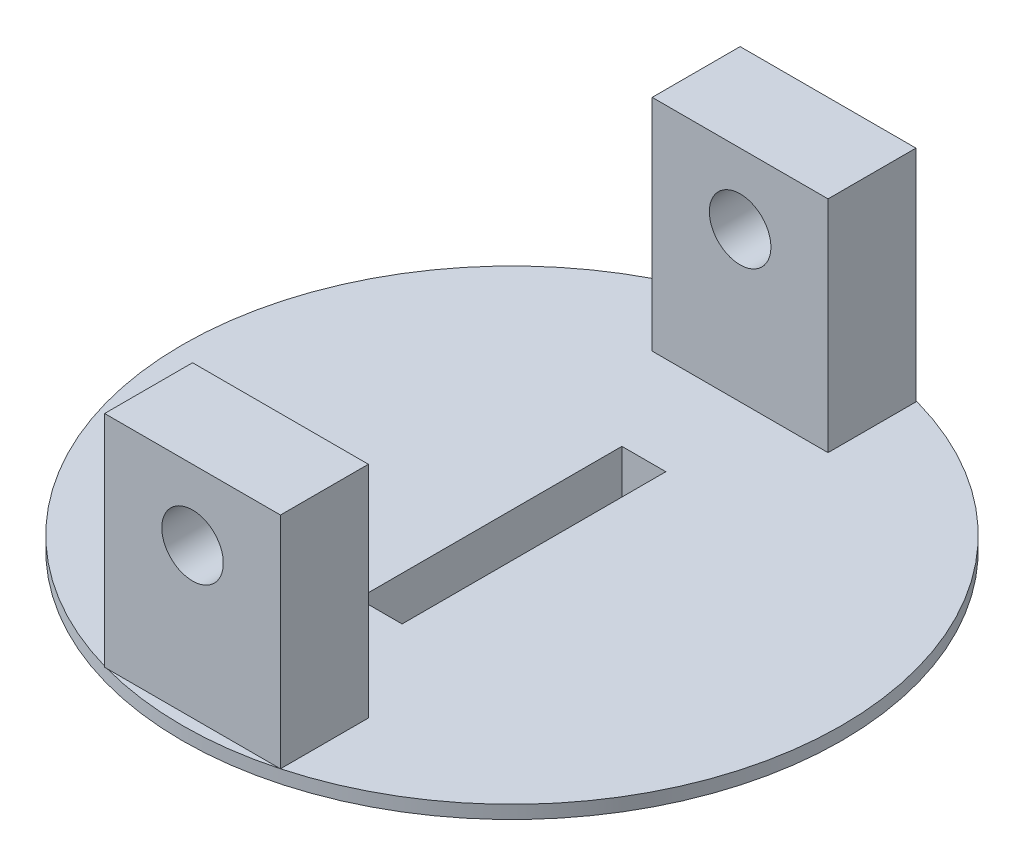
from build123d import *

# Parameters (mm, degrees)
ESQUISSE1_R             = 37.5
BOSS_EXTRU_1_DEPTH      = 1.5
ESQUISSE2_R             = 17.5
BOSS_EXTRU_2_DEPTH      = 8
ESQUISSE4_W             = 20
ESQUISSE4_H             = 72.283474197
BOSS_EXTRU_5_DEPTH      = 25
ESQUISSE11_W            = 52.283474197
ESQUISSE11_H            = 25
ENL_V_MAT_EXTRU_5_DEPTH = 25
ESQUISSE12_R            = 3.5
ENL_V_MAT_EXTRU_8_DEPTH = 87.749161989
ESQUISSE13_W            = 5
ESQUISSE13_H            = 30
ENL_V_MAT_EXTRU_9_DEPTH = 12


with BuildPart() as part:
    # Esquisse1 → Boss.-Extru.1 (new body)
    with BuildSketch(Plane(origin=(0, 0, 0), x_dir=(1, 0, 0), z_dir=(0, 1, 0))):
        Circle(ESQUISSE1_R)
    extrude(amount=BOSS_EXTRU_1_DEPTH)

    # Esquisse2 → Boss.-Extru.2 (add)
    with BuildSketch(Plane(origin=(0, 1.5, 0), x_dir=(1, 0, 0), z_dir=(0, 1, 0))):
        Circle(ESQUISSE2_R)
    extrude(amount=-BOSS_EXTRU_2_DEPTH)

    # Esquisse4 → Boss.-Extru.5 (add)
    with BuildSketch(Plane(origin=(0, 1.5, 0), x_dir=(1, 0, 0), z_dir=(0, 1, 0))):
        with Locations((-0.151898301, -0.042028501)):
            Rectangle(ESQUISSE4_W, ESQUISSE4_H)
    extrude(amount=BOSS_EXTRU_5_DEPTH)

    # Esquisse11 → Enlèv. mat.-Extru.5 (cut)
    with BuildSketch(Plane(origin=(9.848101699, 0, 0), x_dir=(0, 0, -1), z_dir=(1, 0, 0))):
        with Locations((-0.0420285, 14)):
            Rectangle(ESQUISSE11_W, ESQUISSE11_H)
    extrude(amount=-ENL_V_MAT_EXTRU_5_DEPTH, mode=Mode.SUBTRACT)

    # Esquisse12 → Enlèv. mat.-Extru.8 (cut, through all)
    with BuildSketch(Plane(origin=(0, 0, -36.099708598), x_dir=(-1, 0, 0), z_dir=(0, 0, -1))):
        with Locations((0.151898301, 18.5)):
            Circle(ESQUISSE12_R)
    extrude(amount=-ENL_V_MAT_EXTRU_8_DEPTH, mode=Mode.SUBTRACT)

    # Esquisse13 → Enlèv. mat.-Extru.9 (cut)
    with BuildSketch(Plane(origin=(0, 1.5, 0), x_dir=(1, 0, 0), z_dir=(0, 1, 0))):
        Rectangle(ESQUISSE13_W, ESQUISSE13_H)
    extrude(amount=-ENL_V_MAT_EXTRU_9_DEPTH, mode=Mode.SUBTRACT)


solid = part.part
